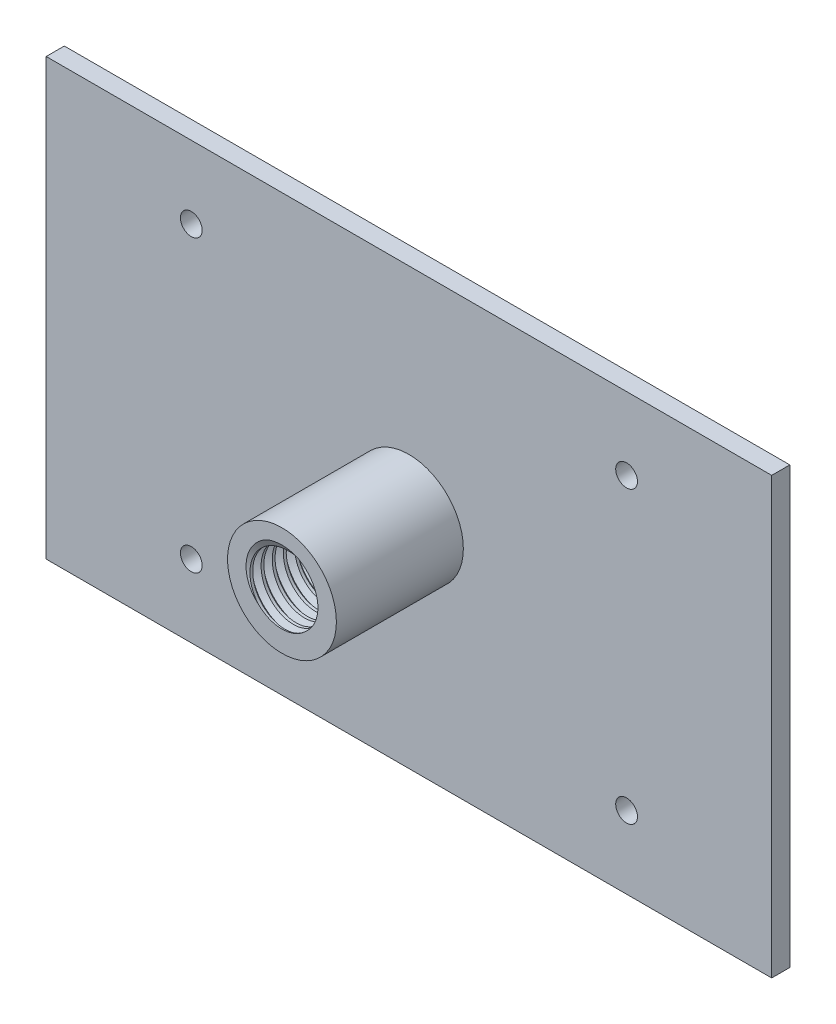
from build123d import *

# Parameters (mm, degrees)
SKETCH1_W               = 127
SKETCH1_H               = 76.2
BOSS_EXTRUDE1_DEPTH     = 3.175
SKETCH2_R               = 9.525
BOSS_EXTRUDE2_DEPTH     = 25.4
F_1_2_13_TAPPED_HOLE3_D = 11.684
THREAD2_PITCH           = 1.953846154
SKETCH12_R              = 1.905
CUT_EXTRUDE1_DEPTH      = 79.288058
CUT_EXTRUDE2_START      = -3.175
SKETCH13_R              = 9.525
CUT_EXTRUDE2_DEPTH      = 3.175


with BuildPart() as part:
    # Sketch1 → Boss-Extrude1 (new body)
    with BuildSketch(Plane.XY):
        Rectangle(SKETCH1_W, SKETCH1_H)
    extrude(amount=BOSS_EXTRUDE1_DEPTH)

    # Sketch2 → Boss-Extrude2 (add)
    with BuildSketch(Plane.XY.offset(3.175)):
        Circle(SKETCH2_R)
    extrude(amount=BOSS_EXTRUDE2_DEPTH)

    # 1/2-13 Tapped Hole3 (through all)
    with Locations(Plane.XY.offset(28.575)):
        with Locations((0, 0)):
            Hole(F_1_2_13_TAPPED_HOLE3_D / 2)

    # Thread2: the profile of Thread Profile2 profile screwed along a right-hand helix of 37.61811 turns, 10 arcs to a turn; built about Z, then put on its axis
    thread2_z = Axis((0, 0, 0), (0, 0, 1))
    thread2_corners = [(5.8417, 0, -0.000173205), (6.899550248, 0, 0.61057692), (6.899550248, 0, 0.85480769), (5.8417, 0, 1.465557815)]
    with BuildLine(mode=Mode.PRIVATE) as thread2_profile:
        Line(thread2_corners[0], thread2_corners[1])
        Line(thread2_corners[1], thread2_corners[2])
        Line(thread2_corners[2], thread2_corners[3])
        Line(thread2_corners[3], thread2_corners[0])
    thread2_cap = Face(thread2_profile.wire())
    thread2_turn_angles = [0, 18, 36, 54, 72, 90, 108, 126, 144, 162, 180, 198, 216, 234, 252, 270, 288, 306, 324, 342, 360, 378, 396, 414, 432, 450, 468, 486, 504, 522, 540, 558, 576, 594, 612, 630, 648, 666, 684, 702, 720]
    thread2_turn_weights = [1, 0.9510565162951535, 1, 0.9510565162951535, 1, 0.9510565162951535, 1, 0.9510565162951535, 1, 0.9510565162951535, 1, 0.9510565162951535, 1, 0.9510565162951535, 1, 0.9510565162951535, 1, 0.9510565162951535, 1, 0.9510565162951535, 1, 0.9510565162951535, 1, 0.9510565162951535, 1, 0.9510565162951535, 1, 0.9510565162951535, 1, 0.9510565162951535, 1, 0.9510565162951535, 1, 0.9510565162951535, 1, 0.9510565162951535, 1, 0.9510565162951535, 1, 0.9510565162951535, 1]
    thread2_turn_rails = [Edge.make_bspline([Vector(p[0], p[1], 0).rotate(thread2_z, thread2_turn_angles[k]) / thread2_turn_weights[k] + Vector(0, 0, p[2] + THREAD2_PITCH * thread2_turn_angles[k] / 360) for k in range(41)], [0, 0, 0, 1, 1, 2, 2, 3, 3, 4, 4, 5, 5, 6, 6, 7, 7, 8, 8, 9, 9, 10, 10, 11, 11, 12, 12, 13, 13, 14, 14, 15, 15, 16, 16, 17, 17, 18, 18, 19, 19, 20, 20, 20], 2, thread2_turn_weights) for p in thread2_corners]
    thread2_turn_sides = [Face.make_surface_from_curves(thread2_turn_rails[p[0]], thread2_turn_rails[p[1]]) for p in [(0, 1), (1, 2), (2, 3), (3, 0)]]
    thread2_last_angles = [12960, 12978, 12996, 13014, 13032, 13050, 13068, 13086, 13104, 13122, 13140, 13158, 13176, 13194, 13212, 13230, 13248, 13266, 13284, 13302, 13320, 13338, 13356, 13374, 13392, 13410, 13428, 13446, 13464, 13482, 13500, 13518, 13536, 13539.25984252, 13542.519685039]
    thread2_last_weights = [1, 0.9510565162951535, 1, 0.9510565162951535, 1, 0.9510565162951535, 1, 0.9510565162951535, 1, 0.9510565162951535, 1, 0.9510565162951535, 1, 0.9510565162951535, 1, 0.9510565162951535, 1, 0.9510565162951535, 1, 0.9510565162951535, 1, 0.9510565162951535, 1, 0.9510565162951535, 1, 0.9510565162951535, 1, 0.9510565162951535, 1, 0.9510565162951535, 1, 0.9510565162951535, 1, 0.9983819168911015, 1]
    thread2_last_rails = [Edge.make_bspline([Vector(p[0], p[1], 0).rotate(thread2_z, thread2_last_angles[k]) / thread2_last_weights[k] + Vector(0, 0, p[2] + THREAD2_PITCH * thread2_last_angles[k] / 360) for k in range(35)], [0, 0, 0, 1, 1, 2, 2, 3, 3, 4, 4, 5, 5, 6, 6, 7, 7, 8, 8, 9, 9, 10, 10, 11, 11, 12, 12, 13, 13, 14, 14, 15, 15, 16, 16, 17, 17, 17], 2, thread2_last_weights) for p in thread2_corners]
    thread2_last_sides = [Face.make_surface_from_curves(thread2_last_rails[p[0]], thread2_last_rails[p[1]]) for p in [(0, 1), (1, 2), (2, 3), (3, 0)]]
    thread2 = Plane(origin=(0, 0, 28.575), x_dir=(-1, 0, 0), z_dir=(0, 0, -1)) * Solid(Shell([*[p.moved(Location((0, 0, 2 * THREAD2_PITCH * i))) for i in range(18) for p in thread2_turn_sides], *thread2_last_sides, thread2_cap, thread2_cap.rotate(thread2_z, 13542.519685039).moved(Location((0, 0, THREAD2_PITCH * 13542.519685039 / 360)))]))
    add(thread2, mode=Mode.SUBTRACT)

    # Sketch12 → Cut-Extrude1 (cut, through all)
    with BuildSketch(Plane.XY.offset(3.175)):
        with Locations((-38.1, 25.4)):
            Circle(SKETCH12_R)
        with Locations((-38.1, -25.4)):
            Circle(SKETCH12_R)
        with Locations((38.1, -25.4)):
            Circle(SKETCH12_R)
        with Locations((38.1, 25.4)):
            Circle(SKETCH12_R)
    extrude(amount=-CUT_EXTRUDE1_DEPTH, mode=Mode.SUBTRACT)

    # Sketch13 → Cut-Extrude2 (cut)
    with BuildSketch(Plane.XY.offset(28.575).offset(CUT_EXTRUDE2_START)):
        Circle(SKETCH13_R)
    extrude(amount=CUT_EXTRUDE2_DEPTH, mode=Mode.SUBTRACT)


solid = part.part
